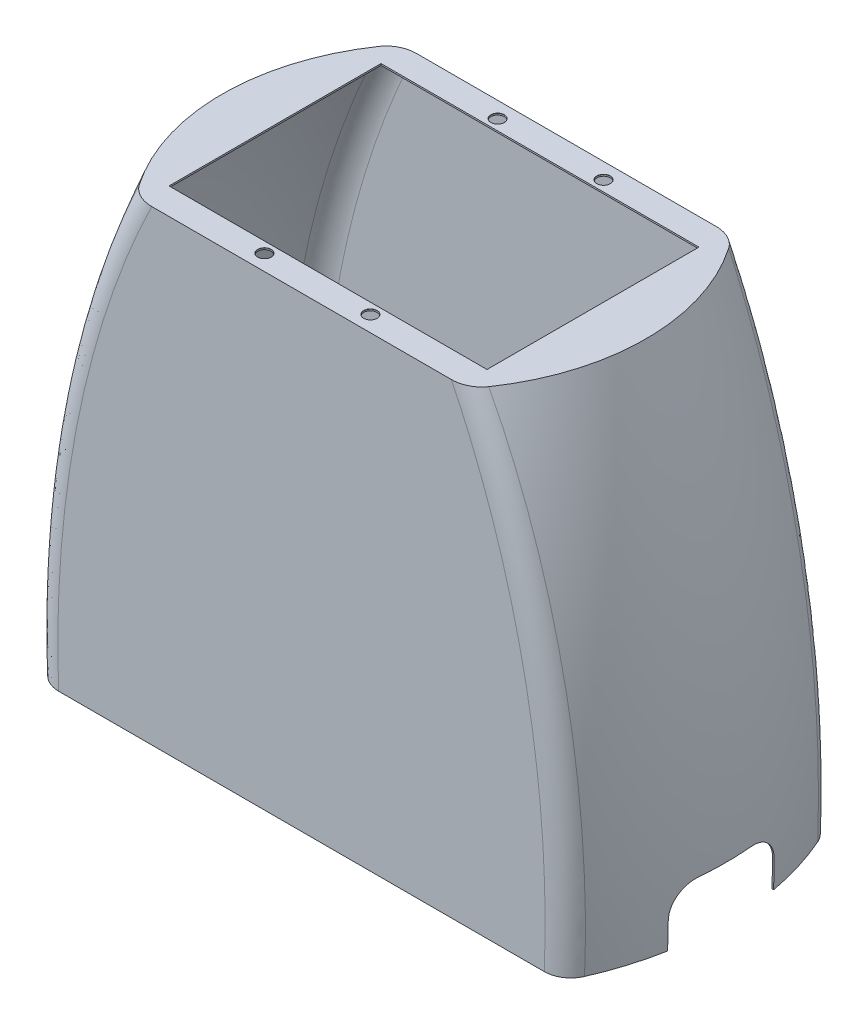
from build123d import *

# Parameters (mm, degrees)
SKETCH5_W                       = 243.514067436
SKETCH5_H                       = 118.33772752
SKETCH5_W_2                     = 120
SKETCH5_H_2                     = 50
CUT_EXTRUDE1_DEPTH              = 90
FILLET1_R                       = 5
SHELL1_T                        = -0.3
CUT_EXTRUDE2_DEPTH              = 90
CUT_EXTRUDE3_DEPTH              = 76
CUT_EXTRUDE3_DEPTH_BACK         = 76
SKETCH10_R                      = 6
CUT_EXTRUDE4_DEPTH              = 70
F_2_5MM_DOWEL_HOLE1_D           = 2.5
F_2_5MM_DOWEL_HOLE1_DEPTH       = 2
F_2_5MM_DOWEL_HOLE1_CSINK_D     = 2.55
F_2_5MM_DOWEL_HOLE1_CSINK_ANGLE = 90
F_2_5MM_DOWEL_HOLE1_TIP         = 0.751075774


with BuildPart() as part:
    # Sketch4 → Revolve1 (revolve)
    with BuildSketch(Plane.XY, mode=Mode.PRIVATE) as revolve1_sk:
        with BuildLine():
            Line((0, 88), (0, 0))
            Line((0, 0), (55, 0))
            ThreePointArc((55, 0), (52.01036462, 44.768812151), (40, 88))
            Line((40, 88), (0, 88))
        make_face()
    revolve(revolve1_sk.sketch.rotate(Axis((0, 0, 0), (0, 1, 0)), 90), axis=Axis((0, 0, 0), (0, 1, 0)))

    # Sketch5 → Cut-Extrude1 (cut)
    with BuildSketch(Plane(origin=(0, 0, 0), x_dir=(1, 0, 0), z_dir=(0, 1, 0))):
        Rectangle(SKETCH5_W, SKETCH5_H)
        Rectangle(SKETCH5_W_2, SKETCH5_H_2, mode=Mode.SUBTRACT)
    extrude(amount=CUT_EXTRUDE1_DEPTH, mode=Mode.SUBTRACT)

    # Fillet1
    fillet1_edges = [part.edges().sort_by_distance(p)[0] for p in [
        (45.540496658, 45.113709991, -25),
        (-45.540496658, 45.113709991, -25),
        (45.540496658, 45.113709991, 25),
        (-45.540496658, 45.113709991, 25),
    ]]
    fillet(fillet1_edges, radius=FILLET1_R)

    # Shell1
    shell1_openings = [part.faces().sort_by_distance(p)[0] for p in [
        (0, 0, 0),
    ]]
    offset(amount=SHELL1_T, openings=shell1_openings)

    # Sketch7 → Cut-Extrude2 (cut)
    with BuildSketch(Plane(origin=(0, 0, 0), x_dir=(1, 0, 0), z_dir=(0, 1, 0))):
        with BuildLine():
            ThreePointArc((25, 20), (28.535533906, 18.535533906), (30, 15))
            Line((30, 15), (30, -15))
            ThreePointArc((30, -15), (28.535533906, -18.535533906), (25, -20))
            Line((25, -20), (-25, -20))
            ThreePointArc((-25, -20), (-28.535533906, -18.535533906), (-30, -15))
            Line((-30, -15), (-30, 15))
            ThreePointArc((-30, 15), (-28.535533906, 18.535533906), (-25, 20))
            Line((-25, 20), (25, 20))
        make_face()
        with BuildLine():
            Line((25, 20), (30, 20))
            Line((30, 20), (30, 15))
            ThreePointArc((30, 15), (28.535533906, 18.535533906), (25, 20))
        make_face()
        with BuildLine():
            ThreePointArc((25, -20), (28.535533906, -18.535533906), (30, -15))
            Line((30, -15), (30, -20))
            Line((30, -20), (25, -20))
        make_face()
        with BuildLine():
            Line((-30, -20), (-25, -20))
            ThreePointArc((-25, -20), (-28.535533906, -18.535533906), (-30, -15))
            Line((-30, -15), (-30, -20))
        make_face()
        with BuildLine():
            ThreePointArc((-25, 20), (-28.535533906, 18.535533906), (-30, 15))
            Line((-30, 15), (-30, 20))
            Line((-30, 20), (-25, 20))
        make_face()
    extrude(amount=CUT_EXTRUDE2_DEPTH, mode=Mode.SUBTRACT)

    # Sketch9 → Cut-Extrude3 (cut, two sides: drawn at the far end of the back side and taken through both)
    with BuildSketch(Plane(origin=(0, 0, 0), x_dir=(0, 0, -1), z_dir=(1, 0, 0)).offset(-CUT_EXTRUDE3_DEPTH_BACK)):
        with BuildLine():
            Line((-5, 10), (5, 10))
            ThreePointArc((5, 10), (8.535533906, 8.535533906), (10, 5))
            Line((10, 5), (10, -10))
            Line((10, -10), (-10, -10))
            Line((-10, -10), (-10, 5))
            ThreePointArc((-10, 5), (-8.535533906, 8.535533906), (-5, 10))
        make_face()
    extrude(amount=CUT_EXTRUDE3_DEPTH + CUT_EXTRUDE3_DEPTH_BACK, mode=Mode.SUBTRACT)

    # Sketch10 → Cut-Extrude4 (cut)
    with BuildSketch(Plane(origin=(0, 0, 0), x_dir=(0, 0, -1), z_dir=(1, 0, 0))):
        with Locations(Location((-13, 31, 0), (0, 0, 315.207467569))):
            Circle(SKETCH10_R)
        with Locations(Location((13, 31, 0), (0, 0, 309.006626455))):
            Circle(SKETCH10_R)
    extrude(amount=-CUT_EXTRUDE4_DEPTH, mode=Mode.SUBTRACT)

    # Ø2.5mm Dowel Hole1
    with Locations(Plane(origin=(0, 88, 0), x_dir=(1, 0, 0), z_dir=(0, 1, 0))):
        with Locations((-10, 22), (10, 22), (10, -22), (-10, -22)):
            CounterSinkHole(F_2_5MM_DOWEL_HOLE1_D / 2, F_2_5MM_DOWEL_HOLE1_CSINK_D / 2, depth=F_2_5MM_DOWEL_HOLE1_DEPTH, counter_sink_angle=F_2_5MM_DOWEL_HOLE1_CSINK_ANGLE)
            with Locations((0, 0, -(F_2_5MM_DOWEL_HOLE1_DEPTH + F_2_5MM_DOWEL_HOLE1_TIP / 2))):  # 118° drill point
                Cone(0, F_2_5MM_DOWEL_HOLE1_D / 2, F_2_5MM_DOWEL_HOLE1_TIP, mode=Mode.SUBTRACT)


solid = part.part
